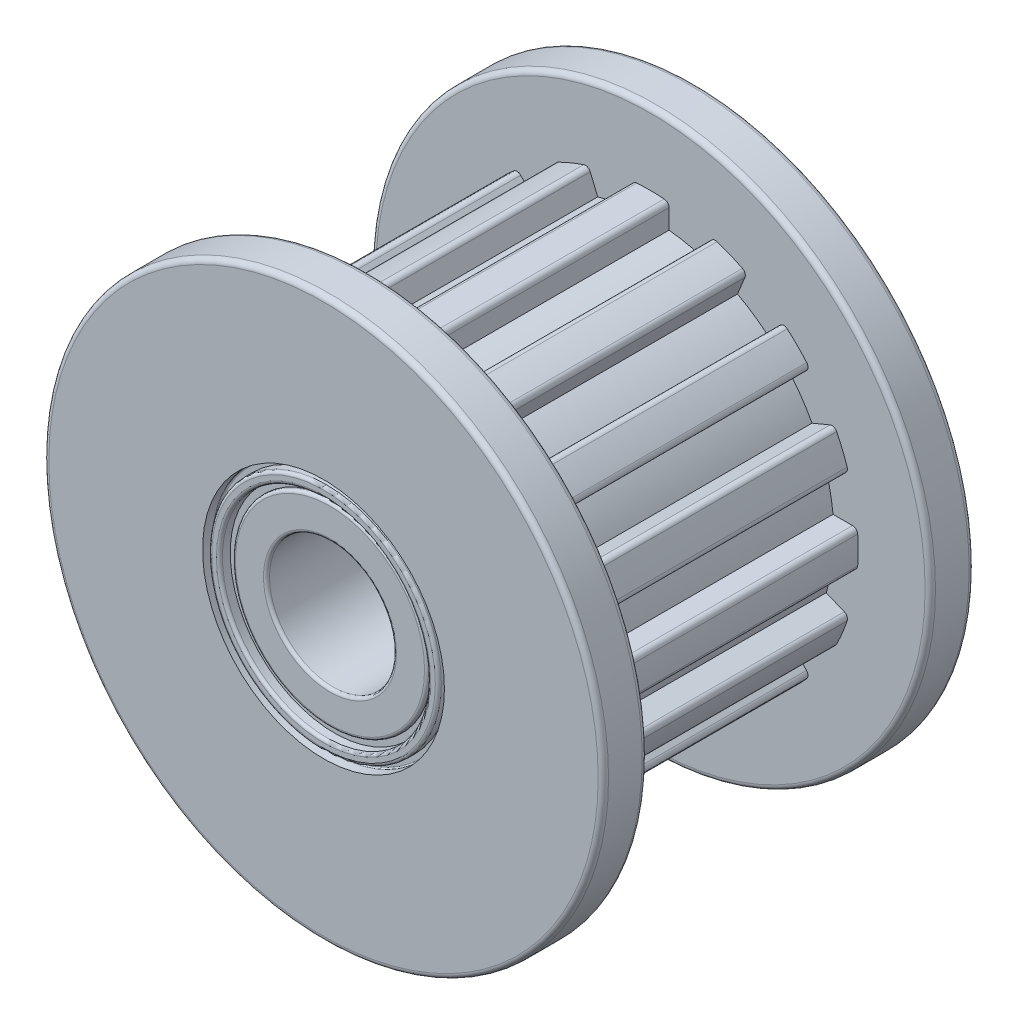
from build123d import *

# Parameters (mm, degrees)
RESSALTO_EXTRUS_O3_DEPTH   = 6.55
ESBO_O3_R                  = 6.48
RESSALTO_EXTRUS_O4_DEPTH   = 1.02
RESSALTO_EXTRUS_O5_START   = 1.02
ESBO_O4_R                  = 6.48
RESSALTO_EXTRUS_O5_DEPTH   = 1.02
FILETE2_R                  = 0.12
CORTE_EXTRUS_O1_DEPTH      = 10
CORTE_EXTRUS_O1_DEPTH_BACK = 10.02
ESBO_O5_R                  = 1.47
ESBO_O6_R                  = 2.26
CORTE_EXTRUS_O3_DEPTH      = 0.15
CORTE_EXTRUS_O4_START      = -0.15
ESBO_O8_R                  = 2.26
CORTE_EXTRUS_O4_DEPTH      = 0.15
ESBO_O9_R                  = 2.41
ESBO_O9_R_2                = 2.26
CORTE_EXTRUS_O7_DEPTH      = 0.25
CORTE_EXTRUS_O8_START      = -0.25
ESBO_O11_R                 = 2.46
ESBO_O11_R_2               = 2.26
CORTE_EXTRUS_O8_DEPTH      = 0.25
FILETE4_R                  = 0.07
FILETE5_R                  = 0.07
ESBO_O12_R                 = 2.8
ESBO_O12_R_2               = 2.66
CORTE_EXTRUS_O10_DEPTH     = 0.25
FILETE6_R                  = 0.07
FILETE7_R                  = 0.03
CORTE_EXTRUS_O11_START     = -0.25
ESBO_O13_R                 = 2.8
ESBO_O13_R_2               = 2.65
CORTE_EXTRUS_O11_DEPTH     = 0.25
FILETE8_R                  = 0.03
FILETE9_R                  = 0.07


with BuildPart() as part:
    # Esboço2 → Ressalto-extrusão3 (new body)
    with BuildSketch(Plane.XY):
        with BuildLine():
            Line((-0.43, 4.679743583), (-0.43, 4.228191103))
            ThreePointArc((-0.43, 4.228191103), (-0.829133869, 4.168337442), (-1.220790485, 4.070893095))
            Line((-1.220790485, 4.070893095), (-1.393592138, 4.488073189))
            ThreePointArc((-1.393592138, 4.488073189), (-1.454894778, 4.551437584), (-1.542951268, 4.55580963))
            ThreePointArc((-1.542951268, 4.55580963), (-1.84070731, 4.443860551), (-2.130412578, 4.312475188))
            ThreePointArc((-2.130412578, 4.312475188), (-2.189586416, 4.247118343), (-2.188128536, 4.158965438))
            Line((-2.188128536, 4.158965438), (-2.015326883, 3.741785343))
            ThreePointArc((-2.015326883, 3.741785343), (-2.36117349, 3.533745852), (-2.685726685, 3.293838517))
            Line((-2.685726685, 3.293838517), (-3.005022506, 3.613134337))
            ThreePointArc((-3.005022506, 3.613134337), (-3.085907265, 3.6482159), (-3.168933963, 3.618557384))
            ThreePointArc((-3.168933963, 3.618557384), (-3.401183618, 3.401183618), (-3.618557384, 3.168933963))
            ThreePointArc((-3.618557384, 3.168933963), (-3.6482159, 3.085907265), (-3.613134337, 3.005022506))
            Line((-3.613134337, 3.005022506), (-3.293838517, 2.685726685))
            ThreePointArc((-3.293838517, 2.685726685), (-3.533745852, 2.36117349), (-3.741785343, 2.015326883))
            Line((-3.741785343, 2.015326883), (-4.158965438, 2.188128536))
            ThreePointArc((-4.158965438, 2.188128536), (-4.247118343, 2.189586416), (-4.312475188, 2.130412578))
            ThreePointArc((-4.312475188, 2.130412578), (-4.443860551, 1.84070731), (-4.55580963, 1.542951268))
            ThreePointArc((-4.55580963, 1.542951268), (-4.551437584, 1.454894778), (-4.488073189, 1.393592138))
            Line((-4.488073189, 1.393592138), (-4.070893095, 1.220790485))
            ThreePointArc((-4.070893095, 1.220790485), (-4.168337442, 0.829133869), (-4.228191103, 0.43))
            Line((-4.228191103, 0.43), (-4.679743583, 0.43))
            ThreePointArc((-4.679743583, 0.43), (-4.761744155, 0.397612249), (-4.799481158, 0.31793177))
            ThreePointArc((-4.799481158, 0.31793177), (-4.81, 0), (-4.799481158, -0.31793177))
            ThreePointArc((-4.799481158, -0.31793177), (-4.761744155, -0.397612249), (-4.679743583, -0.43))
            Line((-4.679743583, -0.43), (-4.228191103, -0.43))
            ThreePointArc((-4.228191103, -0.43), (-4.168337442, -0.829133869), (-4.070893095, -1.220790485))
            Line((-4.070893095, -1.220790485), (-4.488073189, -1.393592138))
            ThreePointArc((-4.488073189, -1.393592138), (-4.551437584, -1.454894778), (-4.55580963, -1.542951268))
            ThreePointArc((-4.55580963, -1.542951268), (-4.443860551, -1.84070731), (-4.312475188, -2.130412578))
            ThreePointArc((-4.312475188, -2.130412578), (-4.247118343, -2.189586416), (-4.158965438, -2.188128536))
            Line((-4.158965438, -2.188128536), (-3.741785343, -2.015326883))
            ThreePointArc((-3.741785343, -2.015326883), (-3.533745852, -2.36117349), (-3.293838517, -2.685726685))
            Line((-3.293838517, -2.685726685), (-3.613134337, -3.005022506))
            ThreePointArc((-3.613134337, -3.005022506), (-3.6482159, -3.085907265), (-3.618557384, -3.168933963))
            ThreePointArc((-3.618557384, -3.168933963), (-3.401183618, -3.401183618), (-3.168933963, -3.618557384))
            ThreePointArc((-3.168933963, -3.618557384), (-3.085907265, -3.6482159), (-3.005022506, -3.613134337))
            Line((-3.005022506, -3.613134337), (-2.685726685, -3.293838517))
            ThreePointArc((-2.685726685, -3.293838517), (-2.400184002, -3.507366071), (-2.097748191, -3.696207858))
            Line((-2.097748191, -3.696207858), (-2.015326883, -3.741785343))
            Line((-2.015326883, -3.741785343), (-2.188128536, -4.158965438))
            ThreePointArc((-2.188128536, -4.158965438), (-2.189586416, -4.247118343), (-2.130412578, -4.312475188))
            ThreePointArc((-2.130412578, -4.312475188), (-1.84070731, -4.443860551), (-1.542951268, -4.55580963))
            ThreePointArc((-1.542951268, -4.55580963), (-1.454894778, -4.551437584), (-1.393592138, -4.488073189))
            Line((-1.393592138, -4.488073189), (-1.220790485, -4.070893095))
            ThreePointArc((-1.220790485, -4.070893095), (-0.829133869, -4.168337442), (-0.43, -4.228191103))
            Line((-0.43, -4.228191103), (-0.43, -4.679743583))
            ThreePointArc((-0.43, -4.679743583), (-0.397612249, -4.761744155), (-0.31793177, -4.799481158))
            ThreePointArc((-0.31793177, -4.799481158), (0, -4.81), (0.31793177, -4.799481158))
            ThreePointArc((0.31793177, -4.799481158), (0.397612249, -4.761744155), (0.43, -4.679743583))
            Line((0.43, -4.679743583), (0.43, -4.228191103))
            ThreePointArc((0.43, -4.228191103), (0.829133869, -4.168337442), (1.220790485, -4.070893095))
            Line((1.220790485, -4.070893095), (1.393592138, -4.488073189))
            ThreePointArc((1.393592138, -4.488073189), (1.454894778, -4.551437584), (1.542951268, -4.55580963))
            ThreePointArc((1.542951268, -4.55580963), (1.84070731, -4.443860551), (2.130412578, -4.312475188))
            ThreePointArc((2.130412578, -4.312475188), (2.189586416, -4.247118343), (2.188128536, -4.158965438))
            Line((2.188128536, -4.158965438), (2.015326883, -3.741785343))
            ThreePointArc((2.015326883, -3.741785343), (2.36117349, -3.533745852), (2.685726685, -3.293838517))
            Line((2.685726685, -3.293838517), (3.005022506, -3.613134337))
            ThreePointArc((3.005022506, -3.613134337), (3.085907265, -3.6482159), (3.168933963, -3.618557384))
            ThreePointArc((3.168933963, -3.618557384), (3.401183618, -3.401183618), (3.618557384, -3.168933963))
            ThreePointArc((3.618557384, -3.168933963), (3.6482159, -3.085907265), (3.613134337, -3.005022506))
            Line((3.613134337, -3.005022506), (3.293838517, -2.685726685))
            ThreePointArc((3.293838517, -2.685726685), (3.533745852, -2.36117349), (3.741785343, -2.015326883))
            Line((3.741785343, -2.015326883), (4.158965438, -2.188128536))
            ThreePointArc((4.158965438, -2.188128536), (4.247118343, -2.189586416), (4.312475188, -2.130412578))
            ThreePointArc((4.312475188, -2.130412578), (4.443860551, -1.84070731), (4.55580963, -1.542951268))
            ThreePointArc((4.55580963, -1.542951268), (4.551437584, -1.454894778), (4.488073189, -1.393592138))
            Line((4.488073189, -1.393592138), (4.070893095, -1.220790485))
            ThreePointArc((4.070893095, -1.220790485), (4.168337442, -0.829133869), (4.228191103, -0.43))
            Line((4.228191103, -0.43), (4.679743583, -0.43))
            ThreePointArc((4.679743583, -0.43), (4.761744155, -0.397612249), (4.799481158, -0.31793177))
            ThreePointArc((4.799481158, -0.31793177), (4.81, 0), (4.799481158, 0.31793177))
            ThreePointArc((4.799481158, 0.31793177), (4.761744155, 0.397612249), (4.679743583, 0.43))
            Line((4.679743583, 0.43), (4.228191103, 0.43))
            ThreePointArc((4.228191103, 0.43), (4.168337442, 0.829133869), (4.070893095, 1.220790485))
            Line((4.070893095, 1.220790485), (4.488073189, 1.393592138))
            ThreePointArc((4.488073189, 1.393592138), (4.551437584, 1.454894778), (4.55580963, 1.542951268))
            ThreePointArc((4.55580963, 1.542951268), (4.443860551, 1.84070731), (4.312475188, 2.130412578))
            ThreePointArc((4.312475188, 2.130412578), (4.247118343, 2.189586416), (4.158965438, 2.188128536))
            Line((4.158965438, 2.188128536), (3.741785343, 2.015326883))
            ThreePointArc((3.741785343, 2.015326883), (3.533745852, 2.36117349), (3.293838517, 2.685726685))
            Line((3.293838517, 2.685726685), (3.613134337, 3.005022506))
            ThreePointArc((3.613134337, 3.005022506), (3.6482159, 3.085907265), (3.618557384, 3.168933963))
            ThreePointArc((3.618557384, 3.168933963), (3.401183618, 3.401183618), (3.168933963, 3.618557384))
            ThreePointArc((3.168933963, 3.618557384), (3.085907265, 3.6482159), (3.005022506, 3.613134337))
            Line((3.005022506, 3.613134337), (2.685726685, 3.293838517))
            ThreePointArc((2.685726685, 3.293838517), (2.36117349, 3.533745852), (2.015326883, 3.741785343))
            Line((2.015326883, 3.741785343), (2.188128536, 4.158965438))
            ThreePointArc((2.188128536, 4.158965438), (2.189586416, 4.247118343), (2.130412578, 4.312475188))
            ThreePointArc((2.130412578, 4.312475188), (1.84070731, 4.443860551), (1.542951268, 4.55580963))
            ThreePointArc((1.542951268, 4.55580963), (1.454894778, 4.551437584), (1.393592138, 4.488073189))
            Line((1.393592138, 4.488073189), (1.220790485, 4.070893095))
            ThreePointArc((1.220790485, 4.070893095), (0.829133869, 4.168337442), (0.43, 4.228191103))
            Line((0.43, 4.228191103), (0.43, 4.679743583))
            ThreePointArc((0.43, 4.679743583), (0.397612249, 4.761744155), (0.31793177, 4.799481158))
            ThreePointArc((0.31793177, 4.799481158), (0, 4.81), (-0.31793177, 4.799481158))
            ThreePointArc((-0.31793177, 4.799481158), (-0.397612249, 4.761744155), (-0.43, 4.679743583))
        make_face()
    extrude(amount=RESSALTO_EXTRUS_O3_DEPTH)

    # Esboço3 → Ressalto-extrusão4 (add)
    with BuildSketch(Plane.XY.offset(6.55)):
        Circle(ESBO_O3_R)
    extrude(amount=RESSALTO_EXTRUS_O4_DEPTH)

    # Esboço4 → Ressalto-extrusão5 (add)
    with BuildSketch(Plane(origin=(0, 0, 0), x_dir=(-1, 0, 0), z_dir=(0, 0, -1)).offset(RESSALTO_EXTRUS_O5_START)):
        Circle(ESBO_O4_R)
    extrude(amount=-RESSALTO_EXTRUS_O5_DEPTH)

    # Filete2
    filete2_edges = [part.edges().sort_by_distance(p)[0] for p in [
        (-6.48, 0, 6.55),
        (6.48, 0, -1.02),
        (6.48, 0, 0),
        (-6.48, 0, 7.57),
    ]]
    fillet(filete2_edges, radius=FILETE2_R)

    # Esboço5 → Corte-extrusão1 (cut, two sides: drawn at the far end of the back side and taken through both)
    with BuildSketch(Plane.XY.offset(7.57).offset(-CORTE_EXTRUS_O1_DEPTH_BACK)):
        Circle(ESBO_O5_R)
    extrude(amount=CORTE_EXTRUS_O1_DEPTH + CORTE_EXTRUS_O1_DEPTH_BACK, mode=Mode.SUBTRACT)

    # Esboço6 → Corte-extrusão3 (cut)
    with BuildSketch(Plane.XY.offset(7.57)):
        Circle(ESBO_O6_R)
    extrude(amount=-CORTE_EXTRUS_O3_DEPTH, mode=Mode.SUBTRACT)

    # Esboço8 → Corte-extrusão4 (cut)
    with BuildSketch(Plane(origin=(0, 0, -1.02), x_dir=(-1, 0, 0), z_dir=(0, 0, -1)).offset(CORTE_EXTRUS_O4_START)):
        Circle(ESBO_O8_R)
    extrude(amount=CORTE_EXTRUS_O4_DEPTH, mode=Mode.SUBTRACT)

    # Esboço9 → Corte-extrusão7 (cut)
    with BuildSketch(Plane.XY.offset(7.57)):
        Circle(ESBO_O9_R)
        Circle(ESBO_O9_R_2, mode=Mode.SUBTRACT)
    extrude(amount=-CORTE_EXTRUS_O7_DEPTH, mode=Mode.SUBTRACT)

    # Esboço11 → Corte-extrusão8 (cut)
    with BuildSketch(Plane(origin=(0, 0, -1.02), x_dir=(-1, 0, 0), z_dir=(0, 0, -1)).offset(CORTE_EXTRUS_O8_START)):
        Circle(ESBO_O11_R)
        Circle(ESBO_O11_R_2, mode=Mode.SUBTRACT)
    extrude(amount=CORTE_EXTRUS_O8_DEPTH, mode=Mode.SUBTRACT)

    # Filete4
    filete4_edges = [part.edges().sort_by_distance(p)[0] for p in [
        (2.26, 0, -0.87),
        (-1.47, 0, -0.87),
    ]]
    fillet(filete4_edges, radius=FILETE4_R)

    # Filete5
    filete5_edges = [part.edges().sort_by_distance(p)[0] for p in [
        (-2.26, 0, 7.42),
        (-1.47, 0, 7.42),
    ]]
    fillet(filete5_edges, radius=FILETE5_R)

    # Esboço12 → Corte-extrusão10 (cut)
    with BuildSketch(Plane.XY.offset(7.57)):
        Circle(ESBO_O12_R)
        Circle(ESBO_O12_R_2, mode=Mode.SUBTRACT)
    extrude(amount=-CORTE_EXTRUS_O10_DEPTH, mode=Mode.SUBTRACT)

    # Filete6
    filete6_edges = [part.edges().sort_by_distance(p)[0] for p in [
        (-2.66, 0, 7.57),
        (-2.41, 0, 7.57),
    ]]
    fillet(filete6_edges, radius=FILETE6_R)

    # Filete7
    filete7_edges = [part.edges().sort_by_distance(p)[0] for p in [
        (-2.8, 0, 7.32),
    ]]
    fillet(filete7_edges, radius=FILETE7_R)

    # Esboço13 → Corte-extrusão11 (cut)
    with BuildSketch(Plane(origin=(0, 0, -1.02), x_dir=(-1, 0, 0), z_dir=(0, 0, -1)).offset(CORTE_EXTRUS_O11_START)):
        Circle(ESBO_O13_R)
        Circle(ESBO_O13_R_2, mode=Mode.SUBTRACT)
    extrude(amount=CORTE_EXTRUS_O11_DEPTH, mode=Mode.SUBTRACT)

    # Filete8
    filete8_edges = [part.edges().sort_by_distance(p)[0] for p in [
        (2.65, 0, -1.02),
        (2.46, 0, -1.02),
    ]]
    fillet(filete8_edges, radius=FILETE8_R)

    # Filete9
    filete9_edges = [part.edges().sort_by_distance(p)[0] for p in [
        (2.8, 0, -1.02),
    ]]
    fillet(filete9_edges, radius=FILETE9_R)


solid = part.part
